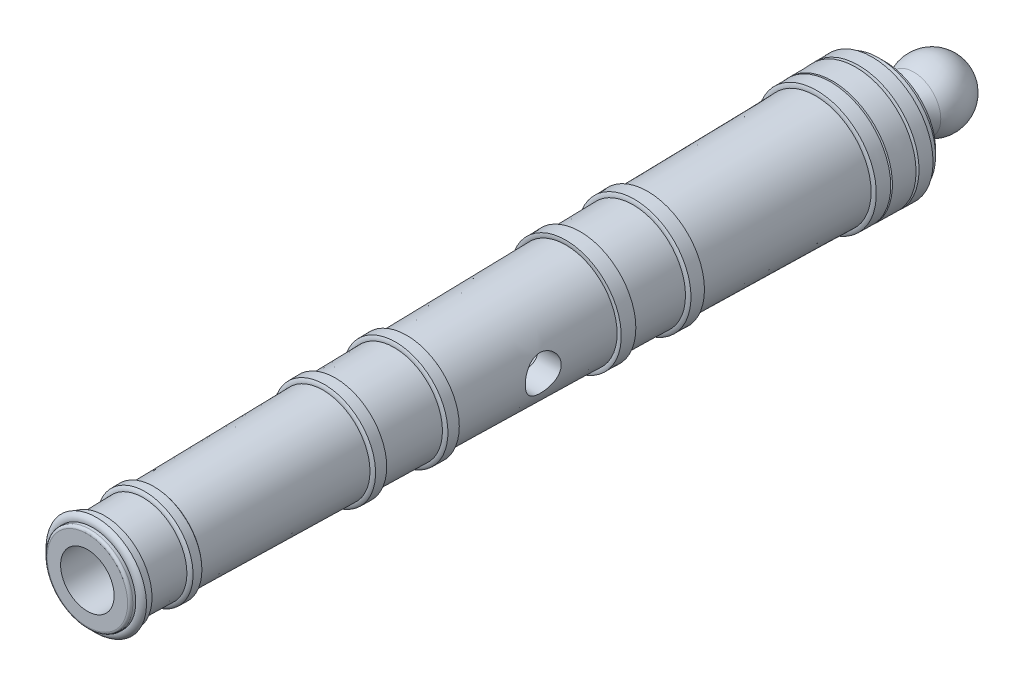
from build123d import *

# Parameters (mm, degrees)
SKETCH1_R           = 10.16
BOSS_EXTRUDE1_DEPTH = 96.266
DRAFT1_ANGLE        = 1
SKETCH3_R           = 1.524
FILLET1_R           = 0.635
SKETCH4_R           = 6.35
CUT_EXTRUDE1_DEPTH  = 177.8
SKETCH7_R           = 1.524
SKETCH9_R           = 1.651
SKETCH11_R          = 1.651
SKETCH13_R          = 1.778
SKETCH15_R          = 1.905
SKETCH16_R          = 4.191
CUT_EXTRUDE2_DEPTH  = 12.7
SKETCH18_R          = 1.9431
SKETCH20_R          = 2.921
SKETCH22_R          = 1.905


with BuildPart() as part:
    # Sketch1 → Boss-Extrude1 (new, symmetric)
    with BuildSketch(Plane.XY):
        Circle(SKETCH1_R)
    extrude(amount=BOSS_EXTRUDE1_DEPTH, both=True)

    # Draft1
    draft1_faces = [part.faces().sort_by_distance(p)[0] for p in [
        (-10.16, 0, 0),
    ]]
    draft(draft1_faces, Plane.XY.offset(96.266), DRAFT1_ANGLE)

    # Sweep1: sweep along a path in Sketch2
    with BuildLine(Plane.XY.offset(93.472)) as sweep1_path:
        CenterArc((0, 0), 10.16, 0, 360)
    # Sketch3 → Sweep1 (sweep)
    with BuildSketch(Plane(origin=(0, 0, 0), x_dir=(1, 0, 0), z_dir=(0, 1, 0))):
        with Locations((-10.450969822, -93.472)):
            Circle(SKETCH3_R)
    sweep(path=sweep1_path.line)

    # Fillet1
    fillet1_edges = [part.edges().sort_by_distance(p)[0] for p in [
        (-10.16, 0, 96.266),
    ]]
    fillet(fillet1_edges, radius=FILLET1_R)

    # Sketch4 → Cut-Extrude1 (cut)
    with BuildSketch(Plane.XY.offset(96.266)):
        Circle(SKETCH4_R)
    extrude(amount=-CUT_EXTRUDE1_DEPTH, mode=Mode.SUBTRACT)

    # Sweep2: sweep along a path in Sketch6
    with BuildLine(Plane.XY.offset(81.534)) as sweep2_path:
        CenterArc((0, 0), 10.377555118, 0, 360)
    # Sketch7 → Sweep2 (sweep)
    with BuildSketch(Plane(origin=(0, 0, 0), x_dir=(1, 0, 0), z_dir=(0, 1, 0))):
        with Locations((-10.272049999, -81.534)):
            Circle(SKETCH7_R)
    sweep(path=sweep2_path.line)

    # Sweep3: sweep along a path in Sketch8
    with BuildLine(Plane.XY.offset(38.735)) as sweep3_path:
        CenterArc((0, 0), 11.176, 0, 360)
    # Sketch9 → Sweep3 (sweep)
    with BuildSketch(Plane(origin=(0, 0, 0), x_dir=(1, 0, 0), z_dir=(0, 1, 0))):
        with Locations((-11.121067971, -38.735)):
            Circle(SKETCH9_R)
    sweep(path=sweep3_path.line)

    # Sweep4: sweep along a path in Sketch10
    with BuildLine(Plane.XY.offset(21.844)) as sweep4_path:
        CenterArc((0, 0), 11.383561293, 0, 360)
    # Sketch11 → Sweep4 (sweep)
    with BuildSketch(Plane(origin=(0, 0, 0), x_dir=(1, 0, 0), z_dir=(0, 1, 0))):
        with Locations((11.459040842, -21.844)):
            Circle(SKETCH11_R)
    sweep(path=sweep4_path.line)

    # Sweep5: sweep along a path in Sketch12
    with BuildLine(Plane.XY.offset(-18.923)) as sweep5_path:
        CenterArc((0, 0), 12.119588541, 0, 360)
    # Sketch13 → Sweep5 (sweep)
    with BuildSketch(Plane(origin=(0, 0, 0), x_dir=(1, 0, 0), z_dir=(0, 1, 0))):
        with Locations((-12.633626754, 18.923)):
            Circle(SKETCH13_R)
    sweep(path=sweep5_path.line)

    # Sweep6: sweep along a path in Sketch14
    with BuildLine(Plane.XY.offset(-35.052)) as sweep6_path:
        CenterArc((0, 0), 12.446, 0, 360)
    # Sketch15 → Sweep6 (sweep)
    with BuildSketch(Plane(origin=(0, 0, 0), x_dir=(1, 0, 0), z_dir=(0, 1, 0))):
        with Locations((-12.358237891, 35.052)):
            Circle(SKETCH15_R)
    sweep(path=sweep6_path.line)

    # Sketch16 → Cut-Extrude2 (cut, symmetric)
    with BuildSketch(Plane(origin=(0, 0, 0), x_dir=(0, 0, -1), z_dir=(1, 0, 0))):
        Circle(SKETCH16_R)
    extrude(amount=CUT_EXTRUDE2_DEPTH, both=True, mode=Mode.SUBTRACT)

    # Sweep7: sweep along a path in Sketch17
    with BuildLine(Plane.XY.offset(-78.359)) as sweep7_path:
        CenterArc((0, 0), 12.7, 0, 360)
    # Sketch18 → Sweep7 (sweep)
    with BuildSketch(Plane(origin=(0, 0, 0), x_dir=(1, 0, 0), z_dir=(0, 1, 0))):
        with Locations((13.208090713, 78.359)):
            Circle(SKETCH18_R)
    sweep(path=sweep7_path.line)

    # Sweep8: sweep along a path in Sketch19
    with BuildLine(Plane.XY.offset(-83.185)) as sweep8_path:
        CenterArc((0, 0), 13.165167036, 0, 360)
    # Sketch20 → Sweep8 (sweep)
    with BuildSketch(Plane(origin=(0, 0, 0), x_dir=(1, 0, 0), z_dir=(0, 1, 0))):
        with Locations((-13.292328856, 83.185)):
            Circle(SKETCH20_R)
    sweep(path=sweep8_path.line)

    # Sweep9: sweep along a path in Sketch21
    with BuildLine(Plane.XY.offset(-88.265)) as sweep9_path:
        CenterArc((0, 0), 13.260744508, 0, 360)
    # Sketch22 → Sweep9 (sweep)
    with BuildSketch(Plane(origin=(0, 0, 0), x_dir=(1, 0, 0), z_dir=(0, 1, 0))):
        with Locations((13.381000586, 88.265)):
            Circle(SKETCH22_R)
    sweep(path=sweep9_path.line)

    # Sketch24 → Cut-Revolve1 (revolve, cut)
    with BuildSketch(Plane(origin=(0, 0, 0), x_dir=(0, 0, -1), z_dir=(1, 0, 0)), mode=Mode.PRIVATE) as cut_revolve1_sk:
        Polygon((-94.09491302, 11.180178979), (103.613491758, 14.631192021), (103.613491758, 22.99281931), (-94.09491302, 19.541806268), align=None)
    revolve(cut_revolve1_sk.sketch.rotate(Axis((0, 0, 94.09491302), (0, 0, 1)), 90), axis=Axis((0, 0, 94.09491302), (0, 0, 1)), mode=Mode.SUBTRACT)

    # Sketch30 → Cut-Revolve2 (revolve, cut)
    with BuildSketch(Plane(origin=(0, 0, 0), x_dir=(0, 0, -1), z_dir=(1, 0, 0)), mode=Mode.PRIVATE) as cut_revolve2_sk:
        Polygon((90.169709859, 13.436415353), (90.169709859, 14.860229661), (98.026290569, 14.860229661), (98.026290569, 0), (93.979709859, 0), (93.979709859, 9.626415353), (93.471709859, 9.626415353), (93.471709859, 10.896415353), (92.709709859, 10.896415353), (92.709709859, 12.166415353), (91.439709859, 12.166415353), (91.439709859, 13.436415353), align=None)
    revolve(cut_revolve2_sk.sketch.rotate(Axis((0, 0, -77.909950756), (0, 0, -1)), 270), axis=Axis((0, 0, -77.909950756), (0, 0, -1)), mode=Mode.SUBTRACT)

    # Sketch31 → Revolve1 (revolve)
    with BuildSketch(Plane(origin=(0, 0, 0), x_dir=(0, 0, -1), z_dir=(1, 0, 0)), mode=Mode.PRIVATE) as revolve1_sk:
        with BuildLine():
            Line((96.265709859, 0), (111.759709859, 0))
            ThreePointArc((111.759709859, 0), (107.651767323, 6.839098608), (99.684514358, 6.425164021))
            add(Edge.make_bspline(
                [(99.684514358, 6.425164021), (94.392303812, 2.860162132), (93.979709859, 7.747)],
                knots=[0, 0, 0, 1, 1, 1], degree=2))
            Line((93.979709859, 7.747), (93.979709859, 0))
            Line((93.979709859, 0), (96.265709859, 0))
        make_face()
    revolve(revolve1_sk.sketch.rotate(Axis((0, 0, -72.29810707), (0, 0, -1)), 270), axis=Axis((0, 0, -72.29810707), (0, 0, -1)))


solid = part.part
